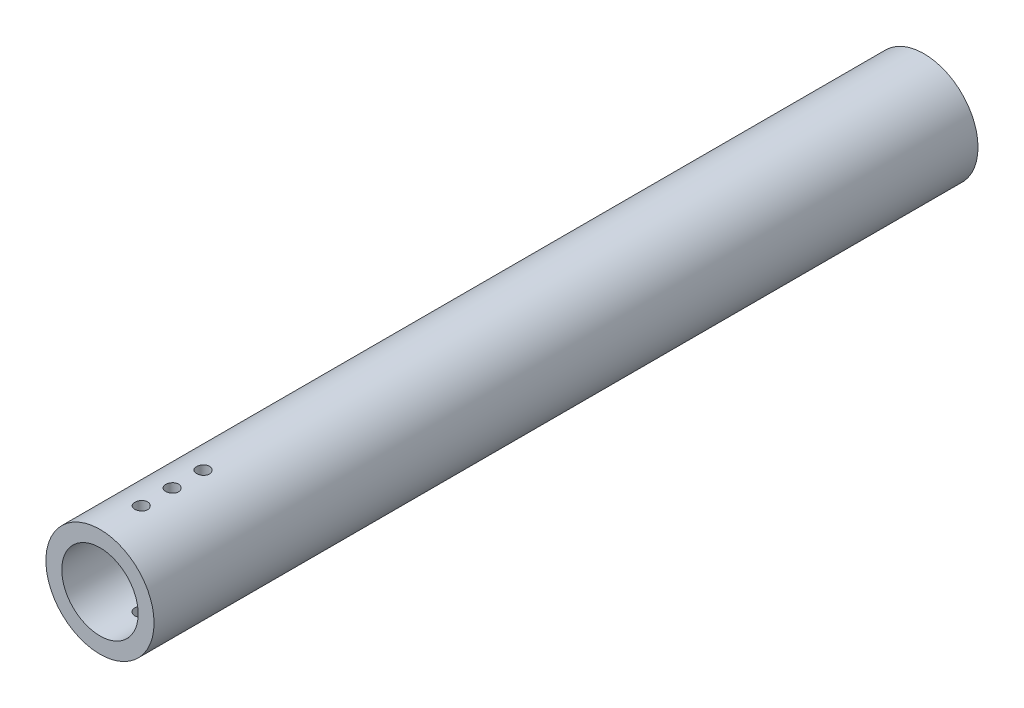
from build123d import *

# Parameters (mm, degrees)
SKETCH1_R               = 13.335
SKETCH1_R_2             = 9.4234
EXTRUDE_THIN1_DEPTH     = 101.6
CUT_EXTRUDE1_DEPTH      = 104.335397856
CUT_EXTRUDE1_DEPTH_BACK = 104.335397856
SKETCH2_R               = 1.5875


with BuildPart() as part:
    # Sketch1 → Extrude-Thin1 (new, symmetric)
    with BuildSketch(Plane.XY):
        Circle(SKETCH1_R)
        Circle(SKETCH1_R_2, mode=Mode.SUBTRACT)
    extrude(amount=EXTRUDE_THIN1_DEPTH, both=True)

    # Sketch2 → Cut-Extrude1 (cut, two sides: drawn at the far end of the back side and taken through both)
    with BuildSketch(Plane(origin=(0, 0, 0), x_dir=(1, 0, 0), z_dir=(0, 1, 0)).offset(-CUT_EXTRUDE1_DEPTH_BACK)):
        with Locations((0, -91.44)):
            Circle(SKETCH2_R)
        with Locations((0, -83.82)):
            Circle(SKETCH2_R)
        with Locations((0, -76.2)):
            Circle(SKETCH2_R)
    extrude(amount=CUT_EXTRUDE1_DEPTH + CUT_EXTRUDE1_DEPTH_BACK, mode=Mode.SUBTRACT)


solid = part.part
